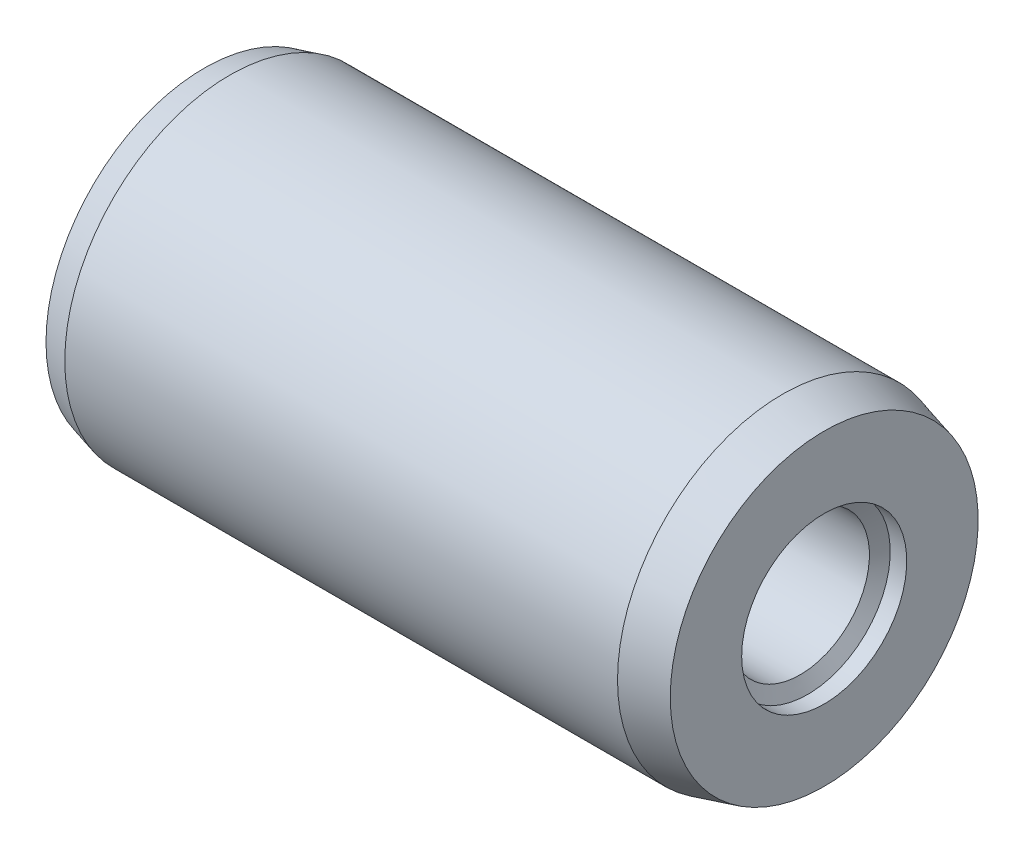
from build123d import *


with BuildPart() as part:
    # Sketch1 → Base-Revolve (revolve)
    with BuildSketch(Plane.XY):
        Polygon((0, 0), (0, 22.320508076), (10, 25), (93.7, 25), (100, 23.311920088), (100, 12.5), (97.5, 12.5), (96.345299462, 10.5), (50, 10.5), (43.6909635, 0), align=None)
    revolve(axis=Axis((-10, 0, 0), (1, 0, 0)))

    # Sketch2 → TypeA (revolve, cut)
    with BuildSketch(Plane.XY):
        with BuildLine():
            Line((6.114035641, 23.958758988), (6.114035641, 30))
            Line((6.114035641, 30), (-5, 30))
            Line((-5, 30), (-5, 0))
            Line((-5, 0), (0, 0))
            ThreePointArc((0, 0), (1.552615045, 12.363288034), (6.114035641, 23.958758988))
        make_face()
    revolve(axis=Axis((0, 0, 0), (1, 0, 0)), mode=Mode.SUBTRACT)


solid = part.part
